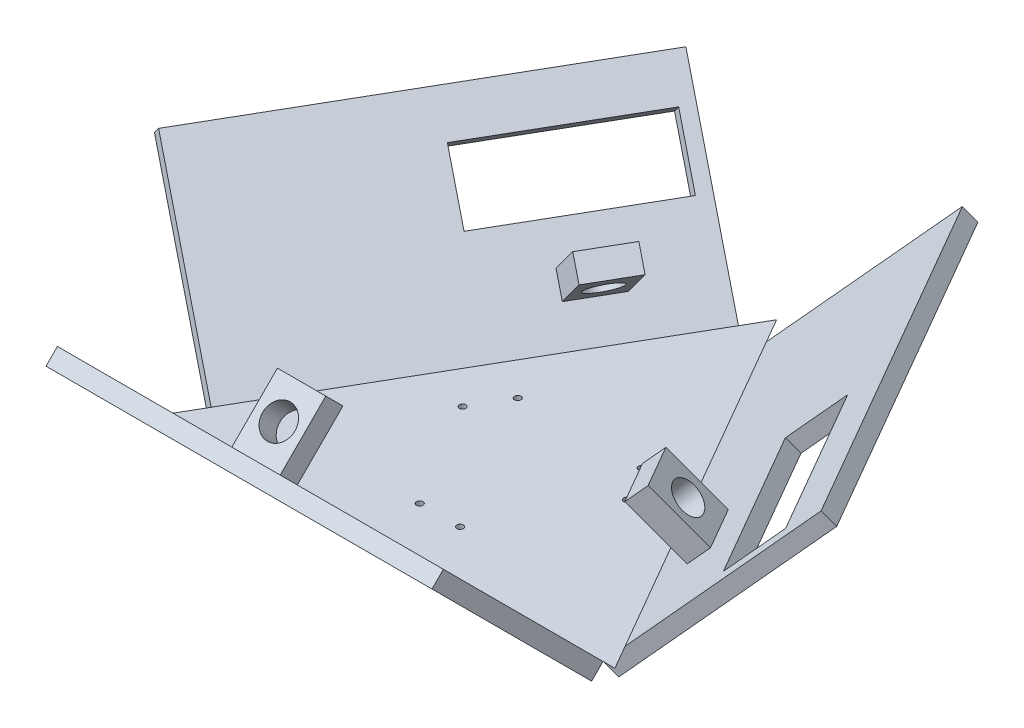
from build123d import *

# Parameters (mm, degrees)
SKETCH1_R           = 2
BOSS_EXTRUDE1_DEPTH = 10
CHAMFER2_SIZE       = 10
BOSS_EXTRUDE2_DEPTH = 10
BOSS_EXTRUDE3_DEPTH = 10
SKETCH6_W           = 239.348674296
SKETCH6_H           = 140
BOSS_EXTRUDE4_DEPTH = 10
CUT_EXTRUDE1_DEPTH  = 10
CUT_EXTRUDE2_DEPTH  = 10
CUT_EXTRUDE3_DEPTH  = 10
BOSS_EXTRUDE5_DEPTH = 40
SKETCH13_R          = 10
CUT_EXTRUDE4_DEPTH  = 15
BOSS_EXTRUDE6_DEPTH = 40
SKETCH15_R          = 10
CUT_EXTRUDE5_DEPTH  = 15
BOSS_EXTRUDE7_DEPTH = 40
SKETCH17_R          = 10
CUT_EXTRUDE6_DEPTH  = 15


with BuildPart() as part:
    # Sketch1 → Boss-Extrude1 (new body)
    with BuildSketch(Plane(origin=(0, 0, 0), x_dir=(1, 0, 0), z_dir=(0, 1, 0))):
        Polygon((0, 181.282032303), (-136.994845224, -56), (136.994845224, -56), align=None)
        with Locations(Location((-38.248711306, 59.033320997, 0), (0, 0, 270))):
            Circle(SKETCH1_R, mode=Mode.SUBTRACT)
        with Locations(Location((-50.748711306, 37.382685902, 0), (0, 0, 270))):
            Circle(SKETCH1_R, mode=Mode.SUBTRACT)
        with Locations(Location((37.748711306, 59.899346401, 0), (0, 0, 270))):
            Circle(SKETCH1_R, mode=Mode.SUBTRACT)
        with Locations(Location((50.248711306, 38.248711306, 0), (0, 0, 270))):
            Circle(SKETCH1_R, mode=Mode.SUBTRACT)
        with Locations(Location((-12, -28, 0), (0, 0, 270))):
            Circle(SKETCH1_R, mode=Mode.SUBTRACT)
        with Locations(Location((13, -28, 0), (0, 0, 270))):
            Circle(SKETCH1_R, mode=Mode.SUBTRACT)
    extrude(amount=BOSS_EXTRUDE1_DEPTH)

    # Chamfer2
    chamfer2_edges = [part.edges().sort_by_distance(p)[0] for p in [
        (68.497422612, 0, -62.641016151),
        (-68.497422612, 0, -62.641016151),
        (0, 0, 56),
    ]]
    chamfer(chamfer2_edges, length=CHAMFER2_SIZE - 0.0001)  # a hair under: the kernel refuses the full size

    # Sketch4 → Boss-Extrude2 (add)
    with BuildSketch(Plane(origin=(34.918584287, -40.320508076, -20.160254038), x_dir=(0.7905694150420945, 0.547722557505166, 0.2738612787525844), z_dir=(0.6123724356957949, -0.7071067811865465, -0.3535533905932751))):
        Polygon((107.208489537, 41.143650786), (215.652023231, -47.400123699), (64.274630088, -232.798809596), (-44.168903606, -144.255035111), align=None)
    extrude(amount=BOSS_EXTRUDE2_DEPTH)

    # Sketch5 → Boss-Extrude3 (add)
    with BuildSketch(Plane(origin=(-34.918584287, -40.320508076, -20.160254038), x_dir=(0.7905694150420941, -0.5477225575051675, -0.27386127875258237), z_dir=(-0.6123724356957955, -0.7071067811865476, -0.35355339059327195))):
        Polygon((44.168903606, -144.255035111), (-64.274630088, -232.798809596), (-215.652023231, -47.400123699), (-107.208489537, 41.143650786), align=None)
    extrude(amount=BOSS_EXTRUDE3_DEPTH)

    # Sketch6 → Boss-Extrude4 (add)
    with BuildSketch(Plane(origin=(0, -23, 23), x_dir=(1, 0, 0), z_dir=(0, -0.7071067811865468, 0.7071067811865483))):
        with Locations((0, 102.526911935)):
            Rectangle(SKETCH6_W, SKETCH6_H)
    extrude(amount=BOSS_EXTRUDE4_DEPTH)

    # Sketch8 → Cut-Extrude1 (cut)
    with BuildSketch(Plane(origin=(-34.918584287, -40.320508076, -20.160254038), x_dir=(0.7905694150420941, -0.5477225575051675, -0.2738612787525823), z_dir=(0.6123724356957955, 0.7071067811865477, 0.35355339059327195))):
        Polygon((-33.923185833, 197.463935256), (-49.415119218, 210.113045896), (-115.822950082, 128.780395626), (-84.839083312, 103.482174345), (-18.431252448, 184.814824615), align=None)
    extrude(amount=-CUT_EXTRUDE1_DEPTH, mode=Mode.SUBTRACT)

    # Sketch10 → Cut-Extrude2 (cut)
    with BuildSketch(Plane(origin=(34.918584287, -40.320508076, -20.160254038), x_dir=(0.7905694150420944, 0.5477225575051661, 0.2738612787525847), z_dir=(-0.6123724356957952, 0.7071067811865464, 0.3535533905932753))):
        Polygon((174.960769477, 24.728878015), (190.452702862, 37.377988656), (124.044871998, 118.710638926), (93.061005228, 93.412417645), (159.468836092, 12.079767374), align=None)
    extrude(amount=-CUT_EXTRUDE2_DEPTH, mode=Mode.SUBTRACT)

    # Sketch11 → Cut-Extrude3 (cut)
    with BuildSketch(Plane(origin=(0, -23, 23), x_dir=(1, 0, 0), z_dir=(0, 0.7071067811865468, -0.7071067811865483))):
        Polygon((-111.5, -126.669047558), (-111.5, -146.669047558), (-6.5, -146.669047558), (-6.5, -106.669047558), (-111.5, -106.669047558), align=None)
    extrude(amount=-CUT_EXTRUDE3_DEPTH, mode=Mode.SUBTRACT)

    # Sketch12 → Boss-Extrude5 (add)
    with BuildSketch(Plane(origin=(-34.918584287, -40.320508076, -20.160254038), x_dir=(0.7905694150420941, -0.5477225575051675, -0.2738612787525823), z_dir=(0.6123724356957955, 0.7071067811865477, 0.35355339059327195))):
        Polygon((-18.910434822, 136.793783558), (-24.719909842, 141.537200048), (-43.693575803, 118.299299971), (-32.074625764, 108.81246699), (-13.100959803, 132.050367067), align=None)
    extrude(amount=BOSS_EXTRUDE5_DEPTH)

    # Sketch13 → Cut-Extrude4 (cut)
    with BuildSketch(Plane(origin=(-66.542804663, 76.83701237, -38.418506185), x_dir=(0.7905694150420933, 0.5477225575051691, -0.27386127875258187), z_dir=(-0.6123724356957966, 0.7071067811865475, -0.35355339059327057))):
        with Locations(Location((21.287016809, 84.607785007, 0), (0, 0, 162.976133815))):
            Circle(SKETCH13_R)
    extrude(amount=-CUT_EXTRUDE4_DEPTH, mode=Mode.SUBTRACT)

    # Sketch14 → Boss-Extrude6 (add)
    with BuildSketch(Plane(origin=(34.918584287, -40.320508076, -20.160254038), x_dir=(0.7905694150420944, 0.5477225575051661, 0.2738612787525847), z_dir=(-0.6123724356957952, 0.7071067811865464, 0.3535533905932753))):
        Polygon((112.513853563, 22.15347651), (118.323328583, 26.896893), (99.349662622, 50.134793077), (87.730712583, 40.647960097), (106.704378544, 17.41006002), align=None)
    extrude(amount=BOSS_EXTRUDE6_DEPTH)

    # Sketch15 → Cut-Extrude5 (cut)
    with BuildSketch(Plane(origin=(66.542804663, 76.83701237, -38.418506185), x_dir=(0.7905694150420963, -0.5477225575051645, 0.2738612787525824), z_dir=(0.6123724356957928, 0.7071067811865488, -0.3535533905932746))):
        with Locations(Location((53.342735971, -6.794621963, 0), (0, 0, 197.023866185))):
            Circle(SKETCH15_R)
    extrude(amount=-CUT_EXTRUDE5_DEPTH, mode=Mode.SUBTRACT)

    # Sketch16 → Boss-Extrude7 (add)
    with BuildSketch(Plane(origin=(0, -23, 23), x_dir=(1, 0, 0), z_dir=(0, 0.7071067811865468, -0.7071067811865483))):
        Polygon((-74, -76.669047558), (-74, -84.169047558), (-44, -84.169047558), (-44, -69.169047558), (-74, -69.169047558), align=None)
    extrude(amount=BOSS_EXTRUDE7_DEPTH)

    # Sketch17 → Cut-Extrude6 (cut)
    with BuildSketch(Plane(origin=(0, 59.516504294, 59.516504294), x_dir=(1, 0, 0), z_dir=(0, 0.7071067811865482, 0.7071067811865468))):
        with Locations(Location((-59, -12.526911935, 0), (0, 0, 270))):
            Circle(SKETCH17_R)
    extrude(amount=-CUT_EXTRUDE6_DEPTH, mode=Mode.SUBTRACT)


solid = part.part
